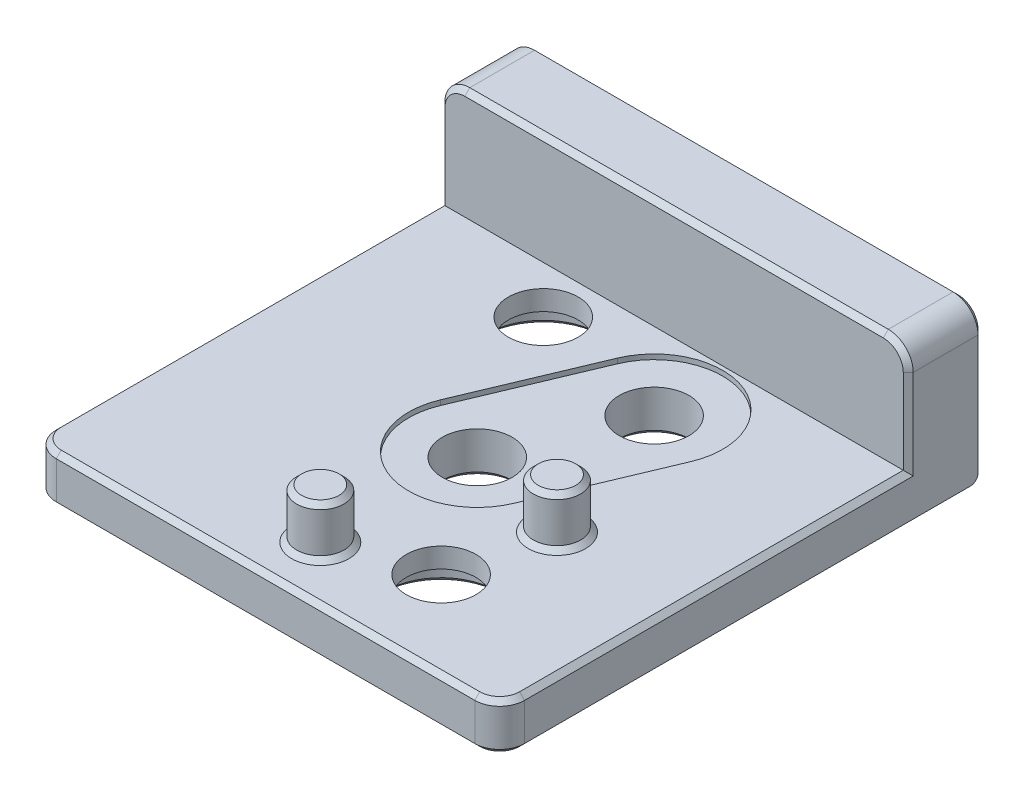
from build123d import *

# Parameters (mm, degrees)
BOSS_EXTRUDE1_DEPTH = 9.4
SKETCH2_R           = 1.4
CUT_EXTRUDE1_DEPTH  = 23.001818107
CUT_EXTRUDE2_DEPTH  = 0.2
SKETCH4_R           = 2.25
CUT_EXTRUDE3_DEPTH  = 1.1
FILLET1_R           = 1
SKETCH5_R           = 0.95
BOSS_EXTRUDE2_DEPTH = 2
FILLET4_R           = 0.5
CHAMFER1_SIZE       = 0.2


with BuildPart() as part:
    # Sketch1 → Boss-Extrude1 (new, symmetric)
    with BuildSketch(Plane(origin=(0, 0, 0), x_dir=(0, 0, -1), z_dir=(1, 0, 0))):
        Polygon((16.4, 0), (0, 0), (0, -1.9), (19.4, -1.9), (19.4, 4.4), (16.4, 4.4), align=None)
    extrude(amount=BOSS_EXTRUDE1_DEPTH, both=True)

    # Sketch2 → Cut-Extrude1 (cut, through all)
    with BuildSketch(Plane(origin=(0, 0, 0), x_dir=(1, 0, 0), z_dir=(0, 1, 0))):
        with Locations((0, 8.5)):
            Circle(SKETCH2_R)
        with Locations((2.1, 13.5)):
            Circle(SKETCH2_R)
        with Locations((3.55, 3.5)):
            Circle(SKETCH2_R)
        with Locations((-3.35, 14.5)):
            Circle(SKETCH2_R)
    extrude(amount=-CUT_EXTRUDE1_DEPTH, mode=Mode.SUBTRACT)

    # Sketch3 → Cut-Extrude2 (cut)
    with BuildSketch(Plane(origin=(0, 0, 0), x_dir=(1, 0, 0), z_dir=(0, 1, 0))):
        with BuildLine():
            Line((-2.53545079, 9.564889332), (-0.43545079, 14.564889332))
            ThreePointArc((-0.43545079, 14.564889332), (3.164889332, 16.03545079), (4.63545079, 12.435110668))
            Line((4.63545079, 12.435110668), (2.53545079, 7.435110668))
            ThreePointArc((2.53545079, 7.435110668), (-1.064889332, 5.96454921), (-2.53545079, 9.564889332))
        make_face()
    extrude(amount=-CUT_EXTRUDE2_DEPTH, mode=Mode.SUBTRACT)

    # Sketch4 → Cut-Extrude3 (cut)
    with BuildSketch(Plane.XZ.offset(1.9)):
        with Locations((-3.35, -14.5)):
            Circle(SKETCH4_R)
        with Locations((3.55, -3.5)):
            Circle(SKETCH4_R)
    extrude(amount=-CUT_EXTRUDE3_DEPTH, mode=Mode.SUBTRACT)

    # Fillet1
    fillet1_edges = [part.edges().sort_by_distance(p)[0] for p in [
        (-9.4, 4.4, -17.9),
        (9.4, 4.4, -17.9),
        (-9.4, -0.95, 0),
        (9.4, -0.95, 0),
    ]]
    fillet(fillet1_edges, radius=FILLET1_R)

    # Sketch5 → Boss-Extrude2 (add)
    with BuildSketch(Plane(origin=(0, 0, 0), x_dir=(1, 0, 0), z_dir=(0, 1, 0))):
        with Locations((0, 2.2)):
            Circle(SKETCH5_R)
        with Locations((4.4, 7.3)):
            Circle(SKETCH5_R)
    extrude(amount=BOSS_EXTRUDE2_DEPTH)

    # Fillet4
    fillet4_edges = [part.edges().sort_by_distance(p)[0] for p in [
        (0, -1.9, -19.4),
    ]]
    fillet(fillet4_edges, radius=FILLET4_R)

    # Chamfer1
    chamfer1_edges = [part.edges().sort_by_distance(p)[0] for p in [
        (9.4, 1.7, -16.4),
        (9.107106781, 4.107106781, -16.4),
        (0, 4.4, -16.4),
        (-9.4, 1.7, -16.4),
        (-9.107106781, 4.107106781, -16.4),
        (9.4, -1.9, -9.95),
        (9.4, -1.753553391, -19.253553391),
        (9.107106781, -1.9, -0.292893219),
        (9.4, 1, -19.4),
        (0, -1.9, 0),
        (9.107106781, 4.107106781, -19.4),
        (-9.107106781, -1.9, -0.292893219),
        (0, 4.4, -19.4),
        (-9.4, -1.9, -9.95),
        (-9.107106781, 4.107106781, -19.4),
        (-9.4, -1.753553391, -19.253553391),
        (-9.4, 1, -19.4),
        (9.4, 0, -8.7),
        (9.107106781, 0, -0.292893219),
        (0, 0, 0),
        (-9.107106781, 0, -0.292893219),
        (-9.4, 0, -8.7),
        (-0.95, 0, -2.2),
        (-0.95, 2, -2.2),
        (3.45, 0, -7.3),
        (3.45, 2, -7.3),
        (-1.4, -1.9, -8.5),
        (0.7, -1.9, -13.5),
        (1.3, -1.9, -3.5),
        (-5.6, -1.9, -14.5),
    ]]
    chamfer(chamfer1_edges, length=CHAMFER1_SIZE)


solid = part.part
